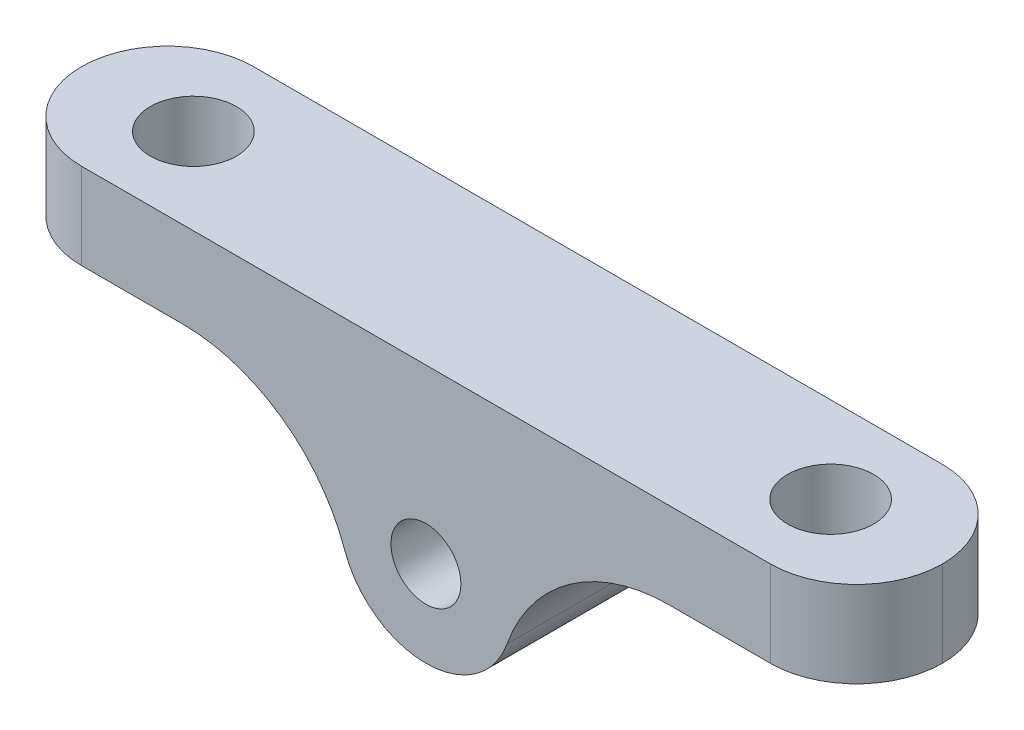
from build123d import *

# Parameters (mm, degrees)
SKETCH1_W           = 63.5
SKETCH1_H           = 6.35
BOSS_EXTRUDE1_DEPTH = 12.7
SKETCH2_R           = 3.175
CUT_EXTRUDE1_DEPTH  = 26.162
FILLET1_R           = 6.35
SKETCH3_R           = 2.5796875
BOSS_EXTRUDE2_DEPTH = 12.7
FILLET2_R           = 12.7


with BuildPart() as part:
    # Sketch1 → Boss-Extrude1 (new body)
    with BuildSketch(Plane.XY):
        with Locations((31.75, -3.175)):
            Rectangle(SKETCH1_W, SKETCH1_H)
    extrude(amount=BOSS_EXTRUDE1_DEPTH)

    # Sketch2 → Cut-Extrude1 (cut)
    with BuildSketch(Plane(origin=(0, 0, 0), x_dir=(1, 0, 0), z_dir=(0, 1, 0))):
        with Locations(Location((8.255, -6.35, 0), (0, 0, 180))):
            Circle(SKETCH2_R)
        with Locations(Location((55.245, -6.35, 0), (0, 0, 180))):
            Circle(SKETCH2_R)
    extrude(amount=-CUT_EXTRUDE1_DEPTH, mode=Mode.SUBTRACT)

    # Fillet1
    fillet1_edges = [part.edges().sort_by_distance(p)[0] for p in [
        (63.5, -3.175, 12.7),
        (63.5, -3.175, 0),
        (0, -3.175, 0),
        (0, -3.175, 12.7),
    ]]
    fillet(fillet1_edges, radius=FILLET1_R - 0.0001)  # a hair under: the kernel refuses the full size

    # Sketch3 → Boss-Extrude2 (add)
    with BuildSketch(Plane.XY.offset(12.7)):
        with BuildLine():
            Line((25.4, -6.35), (38.1, -6.35))
            Line((38.1, -6.35), (38.1, -12.7))
            ThreePointArc((38.1, -12.7), (31.75, -19.05), (25.4, -12.7))
            Line((25.4, -12.7), (25.4, -6.35))
        make_face()
        with Locations((31.75, -12.7)):
            Circle(SKETCH3_R, mode=Mode.SUBTRACT)
    extrude(amount=-BOSS_EXTRUDE2_DEPTH)

    # Fillet2
    fillet2_edges = [part.edges().sort_by_distance(p)[0] for p in [
        (38.1, -6.35, 6.35),
        (25.4, -6.35, 6.35),
    ]]
    fillet(fillet2_edges, radius=FILLET2_R)


solid = part.part
